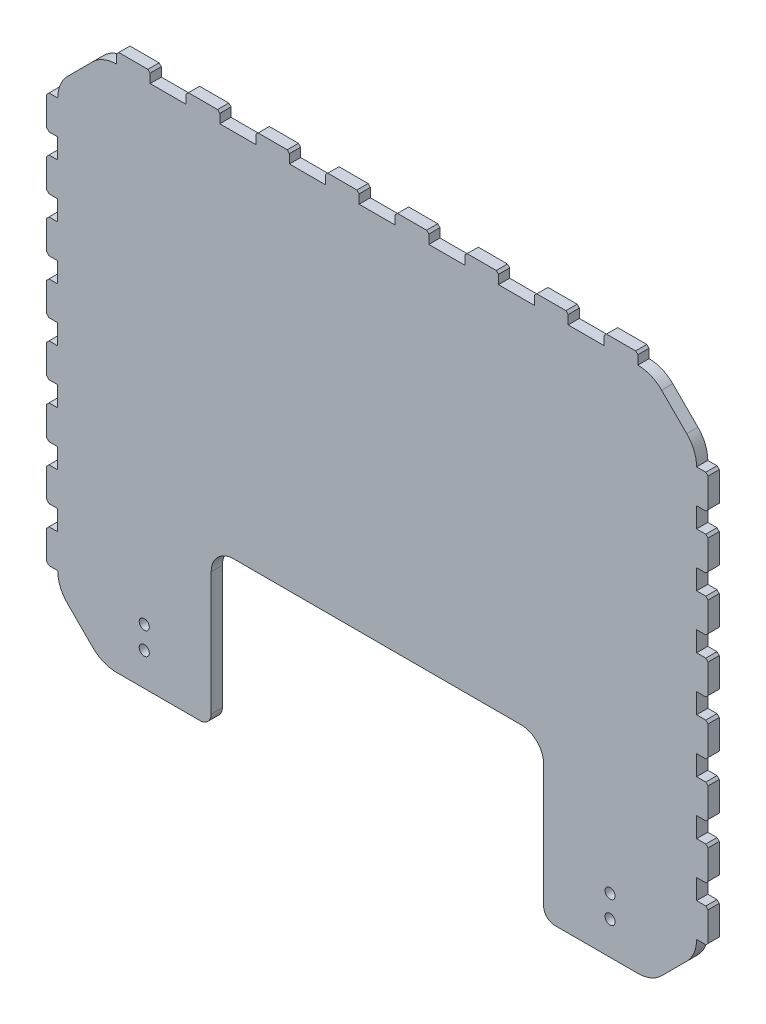
from build123d import *

# Parameters (mm, degrees)
ESQUISSE1_W                    = 285
ESQUISSE1_H                    = 235
BOSS_EXTRU_1_DEPTH             = 5
CHANFREIN1_SIZE                = 20
CONG_1_R                       = 15
ESQUISSE2_R                    = 1.55
ESQUISSE2_R_2                  = 1.5
ENL_V_MAT_EXTRU_1_DEPTH        = 5
ESQUISSE3_W                    = 72
ESQUISSE3_H                    = 25
ENL_V_MAT_EXTRU_2_DEPTH        = 370.425229241
ENL_V_MAT_EXTRU_3_DEPTH        = 370.425229241
ESQUISSE5_R                    = 1.5
ESQUISSE5_R_2                  = 1.55
BOSS_EXTRU_2_DEPTH             = 5
ENL_V_MAT_EXTRU_4_DEPTH        = 370.425229241
CONG_2_R                       = 5
TENON_ET_MORTAISE_TENON1_DEPTH = 5
TENON_ET_MORTAISE_TENON2_DEPTH = 5
TENON_ET_MORTAISE_TENON3_DEPTH = 5
ESQUISSE7_R                    = 2.25
ENL_V_MAT_EXTRU_5_DEPTH        = 374.218448097


# Read off the part's stored shape, not the designer's step: Tenon et mortaise-Tenon1, Tenon et mortaise-Tenon2, Tenon et mortaise-Tenon3
with BuildPart() as part:
    # Esquisse1 → Boss.-Extru.1 (new body)
    with BuildSketch(Plane.XY):
        with Locations((-142.5, -117.5)):
            Rectangle(ESQUISSE1_W, ESQUISSE1_H)
    extrude(amount=BOSS_EXTRU_1_DEPTH)

    # Chanfrein1
    chanfrein1_edges = [part.edges().sort_by_distance(p)[0] for p in [
        (0, -235, 2.5),
        (-285, -235, 2.5),
        (-285, 0, 2.5),
        (0, 0, 2.5),
    ]]
    chamfer(chanfrein1_edges, length=CHANFREIN1_SIZE)

    # Congé1
    cong_1_edges = [part.edges().sort_by_distance(p)[0] for p in [
        (-20, -235, 2.5),
        (-265, -235, 2.5),
        (-285, -20, 2.5),
        (-285, -215, 2.5),
        (0, -20, 2.5),
        (0, -215, 2.5),
        (-265, 0, 2.5),
        (-20, 0, 2.5),
    ]]
    fillet(cong_1_edges, radius=CONG_1_R)

    # Esquisse2 → Enlèv. mat.-Extru.1 (cut)
    with BuildSketch(Plane.XY.offset(5)):
        with Locations((-175.3, -62.2)):
            Circle(ESQUISSE2_R)
        with Locations((-175.3, -93.8)):
            Circle(ESQUISSE2_R)
        with Locations((-99.7, -93.8)):
            Circle(ESQUISSE2_R_2)
        with Locations((-99.7, -62.2)):
            Circle(ESQUISSE2_R)
    extrude(amount=-ENL_V_MAT_EXTRU_1_DEPTH, mode=Mode.SUBTRACT)

    # Esquisse3 → Enlèv. mat.-Extru.2 (cut, through all)
    with BuildSketch(Plane(origin=(0, 0, 0), x_dir=(-1, 0, 0), z_dir=(0, 0, -1))):
        with Locations((137.25, -78.5)):
            Rectangle(ESQUISSE3_W, ESQUISSE3_H)
    extrude(amount=-ENL_V_MAT_EXTRU_2_DEPTH, mode=Mode.SUBTRACT)

    # Esquisse4 → Enlèv. mat.-Extru.3 (cut, through all)
    with BuildSketch(Plane.XY.offset(5)):
        Polygon((-173.25, -71.5), (-177.75, -75.27594834), (-177.75, -82.27594834), (-173.25, -86.051896681), align=None)
    extrude(amount=-ENL_V_MAT_EXTRU_3_DEPTH, mode=Mode.SUBTRACT)

    # Esquisse5 → Boss.-Extru.2 (add, through all)
    with BuildSketch(Plane.XY.offset(5)):
        with Locations((-99.7, -93.8)):
            Circle(ESQUISSE5_R)
        with Locations((-99.7, -62.2)):
            Circle(ESQUISSE5_R_2)
        with Locations((-175.3, -93.8)):
            Circle(ESQUISSE5_R_2)
        with Locations((-175.3, -62.2)):
            Circle(ESQUISSE5_R_2)
        Polygon((-173.25, -86.051896681), (-173.25, -91), (-101.25, -91), (-101.25, -66), (-173.25, -66), (-173.25, -71.5), (-177.75, -75.27594834), (-177.75, -82.27594834), align=None)
    extrude(amount=-BOSS_EXTRU_2_DEPTH)

    # Esquisse6 → Enlèv. mat.-Extru.4 (cut, through all)
    with BuildSketch(Plane.XY.offset(5)):
        with BuildLine():
            Line((-216.542135624, -235), (-68.257864376, -235))
            Line((-68.257864376, -235), (-68.257864376, -175))
            ThreePointArc((-68.257864376, -175), (-71.186796564, -167.928932188), (-78.257864376, -165))
            Line((-78.257864376, -165), (-206.542135624, -165))
            ThreePointArc((-206.542135624, -165), (-213.613203436, -167.928932188), (-216.542135624, -175))
            Line((-216.542135624, -175), (-216.542135624, -235))
        make_face()
    extrude(amount=-ENL_V_MAT_EXTRU_4_DEPTH, mode=Mode.SUBTRACT)

    # Congé2
    cong_2_edges = [part.edges().sort_by_distance(p)[0] for p in [
        (-68.257864376, -235, 2.5),
        (-216.542135624, -235, 2.5),
    ]]
    fillet(cong_2_edges, radius=CONG_2_R)

    # Tenon et mortaise-Tenon1 outline → Tenon et mortaise-Tenon1 (add)
    with BuildSketch(Plane.XY):
        Polygon((-41.213203436, 0), (-26.213203436, 0), (-26.213203436, 4), (-27.213203436, 5), (-40.213203436, 5), (-41.213203436, 4), align=None)
        Polygon((-258.786796564, 0), (-243.786796564, 0), (-243.786796564, 4), (-244.786796564, 5), (-257.786796564, 5), (-258.786796564, 4), align=None)
        Polygon((-227.704854689, 0), (-212.704854689, 0), (-212.704854689, 4), (-213.704854689, 5), (-226.704854689, 5), (-227.704854689, 4), align=None)
        Polygon((-196.622912813, 0), (-181.622912813, 0), (-181.622912813, 4), (-182.622912813, 5), (-195.622912813, 5), (-196.622912813, 4), align=None)
        Polygon((-165.540970938, 0), (-150.540970938, 0), (-150.540970938, 4), (-151.540970938, 5), (-164.540970938, 5), (-165.540970938, 4), align=None)
        Polygon((-134.459029062, 0), (-119.459029062, 0), (-119.459029062, 4), (-120.459029062, 5), (-133.459029062, 5), (-134.459029062, 4), align=None)
        Polygon((-103.377087187, 0), (-88.377087187, 0), (-88.377087187, 4), (-89.377087187, 5), (-102.377087187, 5), (-103.377087187, 4), align=None)
        Polygon((-72.295145311, 0), (-57.295145311, 0), (-57.295145311, 4), (-58.295145311, 5), (-71.295145311, 5), (-72.295145311, 4), align=None)
    extrude(amount=TENON_ET_MORTAISE_TENON1_DEPTH)

    # Tenon et mortaise-Tenon2 outline → Tenon et mortaise-Tenon2 (add)
    with BuildSketch(Plane.XY):
        Polygon((-285, -41.213203436), (-285, -26.213203436), (-288.9, -26.213203436), (-289.9, -27.213203436), (-289.9, -40.213203436), (-288.9, -41.213203436), align=None)
        Polygon((-285, -208.786796564), (-285, -193.786796564), (-288.9, -193.786796564), (-289.9, -194.786796564), (-289.9, -207.786796564), (-288.9, -208.786796564), align=None)
        Polygon((-285, -184.847711832), (-285, -169.847711832), (-288.9, -169.847711832), (-289.9, -170.847711832), (-289.9, -183.847711832), (-288.9, -184.847711832), align=None)
        Polygon((-285, -160.908627099), (-285, -145.908627099), (-288.9, -145.908627099), (-289.9, -146.908627099), (-289.9, -159.908627099), (-288.9, -160.908627099), align=None)
        Polygon((-285, -136.969542366), (-285, -121.969542366), (-288.9, -121.969542366), (-289.9, -122.969542366), (-289.9, -135.969542366), (-288.9, -136.969542366), align=None)
        Polygon((-285, -113.030457634), (-285, -98.030457634), (-288.9, -98.030457634), (-289.9, -99.030457634), (-289.9, -112.030457634), (-288.9, -113.030457634), align=None)
        Polygon((-285, -89.091372901), (-285, -74.091372901), (-288.9, -74.091372901), (-289.9, -75.091372901), (-289.9, -88.091372901), (-288.9, -89.091372901), align=None)
        Polygon((-285, -65.152288168), (-285, -50.152288168), (-288.9, -50.152288168), (-289.9, -51.152288168), (-289.9, -64.152288168), (-288.9, -65.152288168), align=None)
    extrude(amount=TENON_ET_MORTAISE_TENON2_DEPTH)

    # Tenon et mortaise-Tenon3 outline → Tenon et mortaise-Tenon3 (add)
    with BuildSketch(Plane.XY):
        Polygon((4.1, -193.786796564), (0, -193.786796564), (0, -208.786796564), (4.1, -208.786796564), (5.1, -207.786796564), (5.1, -194.786796564), align=None)
        Polygon((4.1, -169.847711832), (0, -169.847711832), (0, -184.847711832), (4.1, -184.847711832), (5.1, -183.847711832), (5.1, -170.847711832), align=None)
        Polygon((4.1, -145.908627099), (0, -145.908627099), (0, -160.908627099), (4.1, -160.908627099), (5.1, -159.908627099), (5.1, -146.908627099), align=None)
        Polygon((4.1, -121.969542366), (0, -121.969542366), (0, -136.969542366), (4.1, -136.969542366), (5.1, -135.969542366), (5.1, -122.969542366), align=None)
        Polygon((4.1, -98.030457634), (0, -98.030457634), (0, -113.030457634), (4.1, -113.030457634), (5.1, -112.030457634), (5.1, -99.030457634), align=None)
        Polygon((4.1, -74.091372901), (0, -74.091372901), (0, -89.091372901), (4.1, -89.091372901), (5.1, -88.091372901), (5.1, -75.091372901), align=None)
        Polygon((4.1, -50.152288168), (0, -50.152288168), (0, -65.152288168), (4.1, -65.152288168), (5.1, -64.152288168), (5.1, -51.152288168), align=None)
        Polygon((4.1, -26.213203436), (0, -26.213203436), (0, -41.213203436), (4.1, -41.213203436), (5.1, -40.213203436), (5.1, -27.213203436), align=None)
    extrude(amount=TENON_ET_MORTAISE_TENON3_DEPTH)

    # Esquisse7 → Enlèv. mat.-Extru.5 (cut, through all)
    with BuildSketch(Plane(origin=(0, 0, 0), x_dir=(-1, 0, 0), z_dir=(0, 0, -1))):
        with Locations((246.4, -210.25)):
            Circle(ESQUISSE7_R)
        with Locations((246.4, -220.25)):
            Circle(ESQUISSE7_R)
    enl_v_mat_extru_5 = extrude(amount=-ENL_V_MAT_EXTRU_5_DEPTH, mode=Mode.SUBTRACT)

    # Symétrie1: Enlèv. mat.-Extru.5 across plane
    add(enl_v_mat_extru_5.mirror(Plane(origin=(-142.5, 0, 0), x_dir=(0, 0, 1), z_dir=(1, 0, 0))), mode=Mode.SUBTRACT)


solid = part.part
